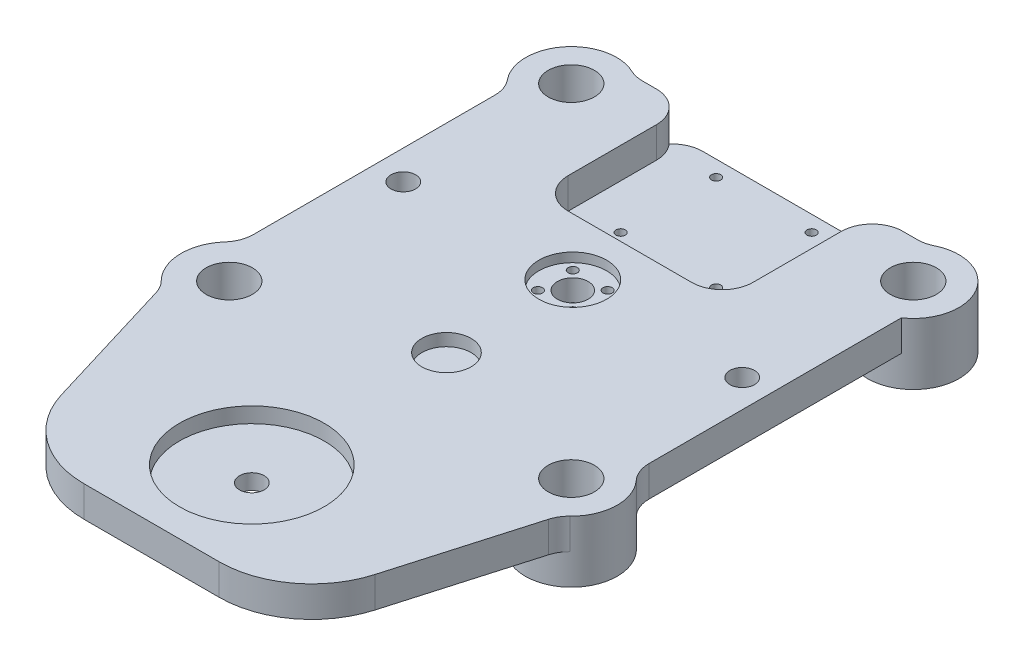
from build123d import *
from build123d.topology import SkipClean

# Parameters (mm, degrees)
SKETCH1_R           = 7.5
BOSS_EXTRUDE1_DEPTH = 20
SKETCH2_R           = 1.5
CUT_EXTRUDE1_DEPTH  = 20
SKETCH4_R           = 5
CUT_EXTRUDE2_DEPTH  = 20
SKETCH5_R           = 11
CUT_EXTRUDE3_DEPTH  = 3
SKETCH6_R           = 1.5
CUT_EXTRUDE4_DEPTH  = 133.625098353
SKETCH7_R           = 8
CUT_EXTRUDE5_DEPTH  = 4
FILLET3_R           = 30
FILLET4_R           = 10
SKETCH9_R           = 23.5
CUT_EXTRUDE6_DEPTH  = 5
SKETCH10_R          = 4
CUT_EXTRUDE7_DEPTH  = 133.383596843
SKETCH11_W          = 60
SKETCH11_H          = 70
CUT_EXTRUDE8_DEPTH  = 10
FILLET5_R           = 10
SKETCH12_R          = 12
CUT_EXTRUDE9_DEPTH  = 10
FILLET6_R           = 10
SKETCH13_R          = 4
CUT_EXTRUDE10_DEPTH = 132.910639121
SKETCH14_R          = 1.5
SKETCH14_R_2        = 5
SKETCH14_R_3        = 4
CUT_EXTRUDE11_DEPTH = 10
FILLET8_R           = 10
FILLET9_R           = 10


with BuildPart() as part:
    # Sketch1 → Boss-Extrude1 (new body)
    with BuildSketch(Plane(origin=(0, 0, 0), x_dir=(1, 0, 0), z_dir=(0, 1, 0))):
        with BuildLine():
            Line((-47.222472379, 93.074011467), (47.342817227, 93.074011467))
            ThreePointArc((47.342817227, 93.074011467), (67.936214726, 89.11955675), (64.041745588, 68.514731035))
            Line((64.041745588, 68.514731035), (64.041745588, -17.873317711))
            ThreePointArc((64.041745588, -17.873317711), (70.589208872, -30.115804346), (64.22965137, -42.456946225))
            Line((64.22965137, -42.456946225), (44.479537272, -110.750576059))
            Line((44.479537272, -110.750576059), (-44.166492384, -110.750576059))
            Line((-44.166492384, -110.750576059), (-64.790239223, -42.659888117))
            ThreePointArc((-64.790239223, -42.659888117), (-70.954867588, -30.058632987), (-64.515200042, -17.595689691))
            Line((-64.515200042, -17.595689691), (-64.515200042, 69.228067604))
            ThreePointArc((-64.515200042, 69.228067604), (-67.278018242, 89.424810491), (-47.222472379, 93.074011467))
        make_face()
        with Locations(Location((-55.343477556, 80.770057168, 0), (0, 0, 270))):
            Circle(SKETCH1_R, mode=Mode.SUBTRACT)
        with Locations(Location((55.656522444, 80.770057168, 0), (0, 0, 270))):
            Circle(SKETCH1_R, mode=Mode.SUBTRACT)
        with Locations(Location((-55.343477556, -30.229942832, 0), (0, 0, 270))):
            Circle(SKETCH1_R, mode=Mode.SUBTRACT)
        with Locations(Location((55.656522444, -30.229942832, 0), (0, 0, 270))):
            Circle(SKETCH1_R, mode=Mode.SUBTRACT)
    extrude(amount=BOSS_EXTRUDE1_DEPTH)

    # Sketch2 → Cut-Extrude1 (cut)
    with BuildSketch(Plane(origin=(0, 20, 0), x_dir=(1, 0, 0), z_dir=(0, 1, 0))):
        with Locations(Location((-15.5, 87.935365278, 0), (0, 0, 270))):
            Circle(SKETCH2_R)
        with Locations(Location((15.5, 87.935365278, 0), (0, 0, 270))):
            Circle(SKETCH2_R)
        with Locations(Location((-15.5, 56.935365278, 0), (0, 0, 270))):
            Circle(SKETCH2_R)
        with Locations(Location((15.5, 56.935365278, 0), (0, 0, 270))):
            Circle(SKETCH2_R)
    extrude(amount=-CUT_EXTRUDE1_DEPTH, mode=Mode.SUBTRACT)

    # Sketch4 → Cut-Extrude2 (cut)
    with BuildSketch(Plane(origin=(0, 20, 0), x_dir=(1, 0, 0), z_dir=(0, 1, 0))):
        with Locations(Location((0, 25.91137957, 0), (0, 0, 270))):
            Circle(SKETCH4_R)
    extrude(amount=-CUT_EXTRUDE2_DEPTH, mode=Mode.SUBTRACT)

    # Sketch5 → Cut-Extrude3 (cut)
    with BuildSketch(Plane(origin=(0, 20, 0), x_dir=(1, 0, 0), z_dir=(0, 1, 0))):
        with Locations(Location((0, 25.91137957, 0), (0, 0, 270))):
            Circle(SKETCH5_R)
    extrude(amount=-CUT_EXTRUDE3_DEPTH, mode=Mode.SUBTRACT)

    # Sketch6 → Cut-Extrude4 (cut, through all)
    with BuildSketch(Plane(origin=(0, 17, 0), x_dir=(1, 0, 0), z_dir=(0, 1, 0))):
        with Locations(Location((-5.656854249, 31.568233819, 0), (0, 0, 270))):
            Circle(SKETCH6_R)
        with Locations(Location((5.656854249, 31.568233819, 0), (0, 0, 270))):
            Circle(SKETCH6_R)
        with Locations(Location((5.656854249, 20.25452532, 0), (0, 0, 270))):
            Circle(SKETCH6_R)
        with Locations(Location((-5.656854249, 20.25452532, 0), (0, 0, 270))):
            Circle(SKETCH6_R)
    extrude(amount=-CUT_EXTRUDE4_DEPTH, mode=Mode.SUBTRACT)

    # Sketch7 → Cut-Extrude5 (cut)
    with BuildSketch(Plane(origin=(0, 20, 0), x_dir=(1, 0, 0), z_dir=(0, 1, 0))):
        with Locations(Location((0, -15.077036946, 0), (0, 0, 270))):
            Circle(SKETCH7_R)
    extrude(amount=-CUT_EXTRUDE5_DEPTH, mode=Mode.SUBTRACT)

    # Fillet3
    fillet3_edges = [part.edges().sort_by_distance(p)[0] for p in [
        (44.479537272, 10, 110.750576059),
        (-44.166492384, 10, 110.750576059),
    ]]
    fillet(fillet3_edges, radius=FILLET3_R)

    # Fillet4
    fillet4_edges = [part.edges().sort_by_distance(p)[0] for p in [
        (64.22965137, 10, 42.456946225),
        (-64.790239223, 10, 42.659888117),
    ]]
    fillet(fillet4_edges, radius=FILLET4_R)

    # Sketch9 → Cut-Extrude6 (cut)
    with BuildSketch(Plane(origin=(0, 20, 0), x_dir=(1, 0, 0), z_dir=(0, 1, 0))):
        with Locations(Location((0, -78.250576059, 0), (0, 0, 270))):
            Circle(SKETCH9_R)
    extrude(amount=-CUT_EXTRUDE6_DEPTH, mode=Mode.SUBTRACT)

    # Sketch10 → Cut-Extrude7 (cut, through all)
    with BuildSketch(Plane(origin=(0, 15, 0), x_dir=(1, 0, 0), z_dir=(0, 1, 0))):
        with Locations(Location((0, -78.250576059, 0), (0, 0, 270))):
            Circle(SKETCH10_R)
    extrude(amount=-CUT_EXTRUDE7_DEPTH, mode=Mode.SUBTRACT)

    # Sketch11 → Cut-Extrude8 (cut)
    with BuildSketch(Plane(origin=(0, 20, 0), x_dir=(1, 0, 0), z_dir=(0, 1, 0))):
        with Locations((0, 79.435365278)):
            Rectangle(SKETCH11_W, SKETCH11_H)
    extrude(amount=-CUT_EXTRUDE8_DEPTH, mode=Mode.SUBTRACT)

    # Fillet5
    fillet5_edges = [part.edges().sort_by_distance(p)[0] for p in [
        (-30, 15, -44.435365278),
        (30, 15, -44.435365278),
    ]]
    fillet(fillet5_edges, radius=FILLET5_R)

    # Sketch12 → Cut-Extrude9 (cut)
    with BuildSketch(Plane.XZ):
        with Locations((-55, -25.91137957)):
            Circle(SKETCH12_R)
        with Locations((55, -25.91137957)):
            Circle(SKETCH12_R)
    extrude(amount=-CUT_EXTRUDE9_DEPTH, mode=Mode.SUBTRACT)

    # Fillet6
    fillet6_edges = [part.edges().sort_by_distance(p)[0] for p in [
        (64.041745588, 5, -18.021713118),
        (64.041745588, 5, -33.801046022),
        (-64.515200042, 5, -33.22308034),
        (-64.515200042, 5, -18.5996788),
    ]]
    fillet(fillet6_edges, radius=FILLET6_R)

    # Sketch13 → Cut-Extrude10 (cut, through all)
    with BuildSketch(Plane.XZ.offset(-10)):
        with Locations(Location((-55, -25.91137957, 0), (0, 0, 270))):
            Circle(SKETCH13_R)
        with Locations(Location((55, -25.91137957, 0), (0, 0, 270))):
            Circle(SKETCH13_R)
    extrude(amount=-CUT_EXTRUDE10_DEPTH, mode=Mode.SUBTRACT)

    # Sketch14 → Cut-Extrude11 (cut)
    with SkipClean():  # the faces are left unmerged after this step: merging them gives an invalid solid
        with BuildSketch(Plane.XZ):
            with BuildLine():
                Line((-35, -93.074011467), (-35, -39.435365278))
                Line((-35, -39.435365278), (35, -39.435365278))
                Line((35, -39.435365278), (35, -93.074011467))
                Line((35, -93.074011467), (47.342817227, -93.074011467))
                ThreePointArc((47.342817227, -93.074011467), (43.376830162, -72.420557586), (64.041745588, -68.514731035))
                Line((64.041745588, -68.514731035), (64.041745588, -47.890500309))
                ThreePointArc((64.041745588, -47.890500309), (61.265169356, -40.975144276), (54.477315775, -37.899990882))
                ThreePointArc((54.477315775, -37.899990882), (43, -25.91137957), (54.477315775, -13.922768257))
                ThreePointArc((54.477315775, -13.922768257), (61.265169356, -10.847614863), (64.041745588, -3.93225883))
                Line((64.041745588, -3.93225883), (64.041745588, 17.873317711))
                ThreePointArc((64.041745588, 17.873317711), (40.77901218, 31.517514149), (66.039971727, 40.96223674))
                ThreePointArc((66.039971727, 40.96223674), (64.425018609, 42.993075226), (63.386912774, 45.371039651))
                Line((63.386912774, 45.371039651), (50.745127533, 89.084883404))
                ThreePointArc((50.745127533, 89.084883404), (39.953399576, 104.730038317), (21.926048417, 110.750576059))
                Line((21.926048417, 110.750576059), (-21.907174195, 110.750576059))
                ThreePointArc((-21.907174195, 110.750576059), (-39.783231267, 104.843035119), (-50.619052406, 89.447014961))
                Line((-50.619052406, 89.447014961), (-63.975713192, 45.349100617))
                ThreePointArc((-63.975713192, 45.349100617), (-64.954881243, 43.13060481), (-66.439269442, 41.213032024))
                ThreePointArc((-66.439269442, 41.213032024), (-39.782701565, 31.497655875), (-64.515200042, 17.595689691))
                Line((-64.515200042, 17.595689691), (-64.515200042, -3.916721832))
                ThreePointArc((-64.515200042, -3.916721832), (-61.663753608, -10.90944533), (-54.735563659, -13.914293531))
                ThreePointArc((-54.735563659, -13.914293531), (-43, -25.91137957), (-54.735563659, -37.908465609))
                ThreePointArc((-54.735563659, -37.908465609), (-61.663753608, -40.91331381), (-64.515200042, -47.906037308))
                Line((-64.515200042, -47.906037308), (-64.515200042, -69.228067604))
                ThreePointArc((-64.515200042, -69.228067604), (-43.40893687, -72.115303846), (-47.222472379, -93.074011467))
                Line((-47.222472379, -93.074011467), (-35, -93.074011467))
            make_face()
            with Locations(Location((-5.656854249, -31.568233819, 0), (0, 0, 90))):
                Circle(SKETCH14_R, mode=Mode.SUBTRACT)
            with Locations(Location((-5.656854249, -20.25452532, 0), (0, 0, 90))):
                Circle(SKETCH14_R, mode=Mode.SUBTRACT)
            with Locations(Location((5.656854249, -31.568233819, 0), (0, 0, 90))):
                Circle(SKETCH14_R, mode=Mode.SUBTRACT)
            with Locations(Location((0, -25.91137957, 0), (0, 0, 90))):
                Circle(SKETCH14_R_2, mode=Mode.SUBTRACT)
            with Locations(Location((5.656854249, -20.25452532, 0), (0, 0, 90))):
                Circle(SKETCH14_R, mode=Mode.SUBTRACT)
            with Locations(Location((0, 78.250576059, 0), (0, 0, 90))):
                Circle(SKETCH14_R_3, mode=Mode.SUBTRACT)
        extrude(amount=-CUT_EXTRUDE11_DEPTH, mode=Mode.SUBTRACT)

    # Fillet8
    # the kernel refuses this fillet: 10 mm, written as the material it adds along each edge
    with BuildSketch(Plane(origin=(-47.222472379, 10, -93.074011467), x_dir=(-0.8700239492494848, 0, -0.4930094600840129), z_dir=(0, 1, 0))) as fillet8_piece_1:
        with BuildLine():
            CenterArc((2.676985366, -9.976990745), FILLET8_R, 93.887516216, 25.651061108)
            Line((-2.253109235, -1.276751253), (0, 0))
            ThreePointArc((0, 0), (0.999503131, -0.033921137), (1.999006261, 0))
        make_face()
    extrude(amount=10)
    with BuildSketch(Plane(origin=(47.342817227, 10, -93.074011467), x_dir=(-1, 0, 0), z_dir=(0, 1, 0))) as fillet8_piece_2:
        with BuildLine():
            CenterArc((2.641969758, -10), FILLET8_R, 90, 26.160214117)
            ThreePointArc((-1.766857191, -1.024352674), (-0.865797103, -0.542588059), (0, 0))
            Line((0, 0), (2.641969758, 0))
        make_face()
    extrude(amount=10)
    with BuildSketch(Plane(origin=(64.041745588, 10, 17.873317711), x_dir=(0, 0, -1), z_dir=(0, 1, 0))) as fillet8_piece_3:
        with BuildLine():
            CenterArc((4.485113927, -10), FILLET8_R, 90, 42.491166092)
            ThreePointArc((-2.269651329, -2.626185089), (-1.058262626, -1.379261301), (0, 0))
            Line((0, 0), (4.485113927, 0))
        make_face()
    extrude(amount=10)
    with BuildSketch(Plane(origin=(-64.515200042, 10, 17.595689691), x_dir=(-0.7405638578524667, 0, 0.6719859912547816), z_dir=(0, 1, 0))) as fillet8_piece_4:
        with BuildLine():
            CenterArc((4.483060436, -9.940694531), FILLET8_R, 96.243093942, 41.536375837)
            Line((-2.922578142, -3.220834618), (0, 0))
            ThreePointArc((0, 0), (1.697794933, -0.092589655), (3.395589866, 0))
        make_face()
    extrude(amount=10)
    with BuildSketch(Plane(origin=(-64.515200042, 10, -69.228067604), x_dir=(0, 0, 1), z_dir=(0, 1, 0))) as fillet8_piece_5:
        with BuildLine():
            CenterArc((4.098689509, -10), FILLET8_R, 90, 39.20826159)
            ThreePointArc((-2.22272086, -2.251466529), (-1.050788512, -1.185531829), (0, 0))
            Line((0, 0), (4.098689509, 0))
        make_face()
    extrude(amount=10)
    # the kernel refuses this fillet: 10 mm, written as the material it takes off along each edge
    with BuildSketch(Plane(origin=(-30, 10, -93.074011467), x_dir=(0, 0, 1), z_dir=(0, 1, 0)), Plane(origin=(35, -25, -39.435365278), x_dir=(-1, 0, 0), z_dir=(0, 1, 0)), Plane(origin=(-35, -25, -39.435365278), x_dir=(0, 0, -1), z_dir=(0, 1, 0))) as fillet8_2_piece_1:
        with BuildLine():
            CenterArc((FILLET8_R, -FILLET8_R), FILLET8_R, 90, 90)
            Line((0, -FILLET8_R), (0, 0))
            Line((0, 0), (FILLET8_R, 0))
        make_face()
    extrude(amount=35, mode=Mode.SUBTRACT)
    with BuildSketch(Plane(origin=(30, 45, -93.074011467), x_dir=(1, 0, 0), z_dir=(0, -1, 0))) as fillet8_2_piece_2:
        with BuildLine():
            CenterArc((FILLET8_R, FILLET8_R), FILLET8_R, 180, 90)
            Line((0, FILLET8_R), (0, 0))
            Line((0, 0), (FILLET8_R, 0))
        make_face()
    extrude(amount=35, mode=Mode.SUBTRACT)

    # Fillet9
    # the kernel refuses this fillet: 10 mm, written as the material it takes off along each edge
    with BuildSketch(Plane(origin=(35, -25, -93.074011467), x_dir=(0, 0, 1), z_dir=(0, 1, 0))) as fillet9_piece_1:
        with BuildLine():
            CenterArc((FILLET9_R, -FILLET9_R), FILLET9_R, 90, 90)
            Line((0, -FILLET9_R), (0, 0))
            Line((0, 0), (FILLET9_R, 0))
        make_face()
    extrude(amount=35, mode=Mode.SUBTRACT)
    with BuildSketch(Plane(origin=(-35, -25, -93.074011467), x_dir=(0, 0, 1), z_dir=(0, 1, 0))) as fillet9_piece_2:
        with BuildLine():
            CenterArc((FILLET9_R, FILLET9_R), FILLET9_R, 180, 90)
            Line((0, FILLET9_R), (0, 0))
            Line((0, 0), (FILLET9_R, 0))
        make_face()
    extrude(amount=35, mode=Mode.SUBTRACT)


solid = part.part
